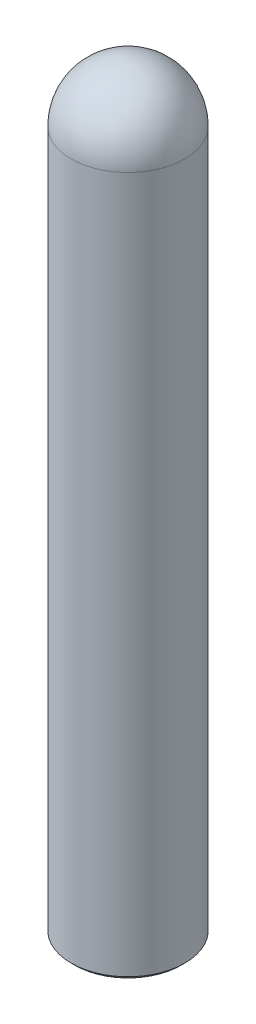
from build123d import *

# Parameters (mm, degrees)
SKETCH1_R           = 15
BOSS_EXTRUDE1_DEPTH = 200
FILLET1_R           = 15
SKETCH2_R           = 3.175
CUT_EXTRUDE1_DEPTH  = 12
CHAMFER1_SIZE       = 0.4
CHAMFER2_SIZE       = 1


with BuildPart() as part:
    # Sketch1 → Boss-Extrude1 (new body)
    with BuildSketch(Plane(origin=(0, 0, 0), x_dir=(1, 0, 0), z_dir=(0, 1, 0))):
        Circle(SKETCH1_R)
    extrude(amount=BOSS_EXTRUDE1_DEPTH)

    # Fillet1
    fillet1_edges = [part.edges().sort_by_distance(p)[0] for p in [
        (-15, 200, 0),
    ]]
    fillet(fillet1_edges, radius=FILLET1_R)

    # Sketch2 → Cut-Extrude1 (cut)
    with BuildSketch(Plane.XZ):
        Circle(SKETCH2_R)
    extrude(amount=-CUT_EXTRUDE1_DEPTH, mode=Mode.SUBTRACT)

    # Chamfer1
    chamfer1_edges = [part.edges().sort_by_distance(p)[0] for p in [
        (-3.175, 0, 0),
    ]]
    chamfer(chamfer1_edges, length=CHAMFER1_SIZE)

    # Chamfer2
    chamfer2_edges = [part.edges().sort_by_distance(p)[0] for p in [
        (-15, 0, 0),
    ]]
    chamfer(chamfer2_edges, length=CHAMFER2_SIZE)


solid = part.part
